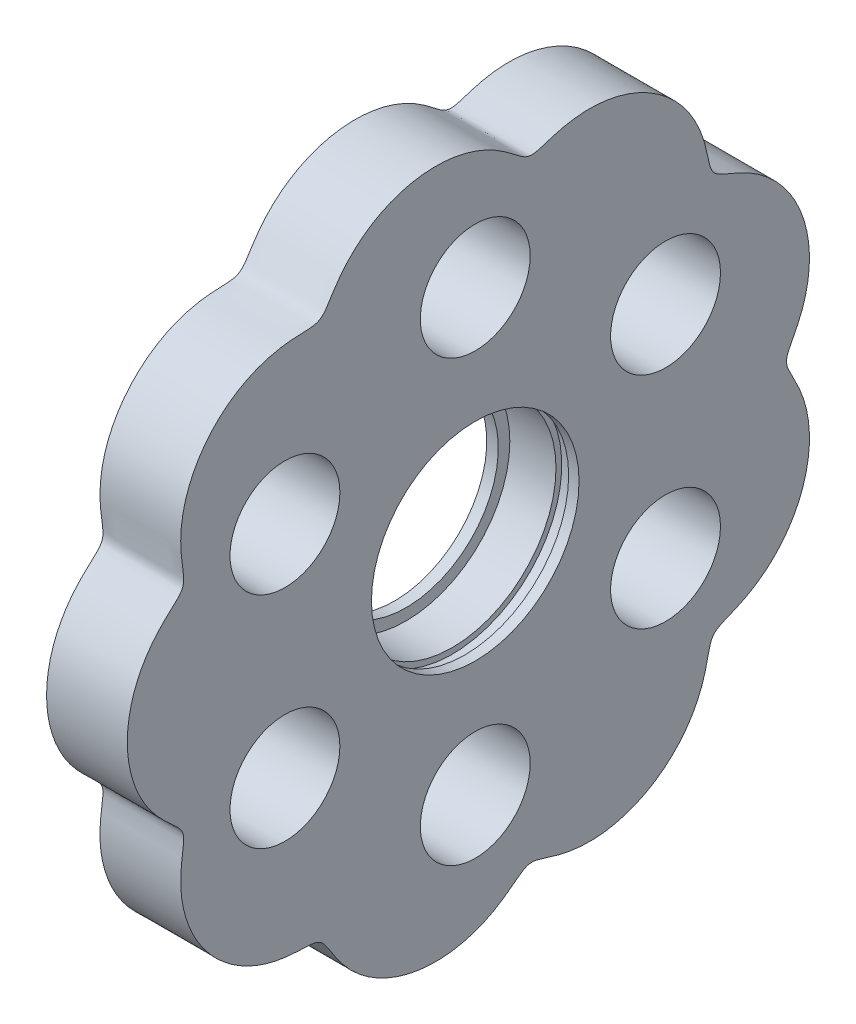
from build123d import *

# Parameters (mm, degrees)
SKETCH1_R           = 9
SKETCH1_R_2         = 4.7625
BOSS_EXTRUDE1_DEPTH = 7
SKETCH2_R           = 9
SKETCH2_R_2         = 8
BOSS_EXTRUDE2_DEPTH = 1
SKETCH3_W           = 1.1
SKETCH3_H           = 0.5


with BuildPart() as part:
    # Sketch1 → Boss-Extrude1 (new body)
    with BuildSketch(Plane(origin=(0, 0, 0), x_dir=(0, 0, -1), z_dir=(1, 0, 0))):
        with BuildLine():
            ThreePointArc((26.9875, 0), (26.989123063, 0.064428515), (26.993988134, 0.128693583))
            add(Edge.make_bspline(
                [(26.9875, 0), (26.9875, -0.014073053), (26.988080566, -0.04216838), (26.990693151, -0.098787465), (26.997566131, -0.167176816), (27.011607904, -0.256879897), (27.033011718, -0.352674617), (27.0616083, -0.450501981), (27.098613831, -0.556498791), (27.133591317, -0.6462128), (27.183968387, -0.76444502), (27.252007699, -0.910080875), (27.336032854, -1.077701998), (27.455718752, -1.30705574), (27.597856204, -1.57474085), (27.80354162, -1.969957187), (28.145202617, -2.675735442), (28.540539243, -3.68089166), (28.877472665, -5.016535689), (29.022846048, -6.583933195), (28.928181395, -8.154951368), (28.601973214, -9.68098236), (28.059488998, -11.129567329), (27.318557234, -12.472277494), (26.398579392, -13.682406664), (25.310802865, -14.74486271), (24.07633584, -15.632357808), (22.956941414, -16.211533455), (22.030542721, -16.581356678), (21.383868913, -16.848359145), (21.039971521, -17.024040788), (20.780870826, -17.218046158), (20.591835225, -17.434787286), (20.448078085, -17.697233393), (20.341895515, -18.007222586), (20.229665409, -18.462096546), (20.112569683, -19.033830244), (19.913989937, -19.89900933), (19.550925005, -21.036166088), (18.958770336, -22.300031894), (18.065217297, -23.621119938), (16.978610669, -24.788373978), (15.741019462, -25.766354253), (14.387035597, -26.540708274), (12.950394161, -27.102330148), (11.464153861, -27.444757575), (9.943334465, -27.564927227), (8.421845995, -27.455332003), (7.187326629, -27.181326733), (6.23642371, -26.869347958), (5.567462677, -26.656649116), (5.190408681, -26.568056964), (4.865818731, -26.546968949), (4.57811405, -26.588573801), (4.247438806, -26.715195963), (3.836602547, -26.983308712), (3.342170064, -27.376164818), (2.74947569, -27.832837508), (2.084212051, -28.286030242), (1.213182535, -28.790565586), (0.109473529, -29.285207916), (-1.245718232, -29.687650048), (-2.847070207, -29.899957538), (-4.426522985, -29.863959108), (-5.947788484, -29.600335351), (-7.381258538, -29.131775206), (-8.703129432, -28.482181721), (-9.919254868, -27.651038413), (-10.867639742, -26.778009507), (-11.58362681, -25.93899488), (-12.090852754, -25.226953653), (-12.440028359, -24.682791811), (-12.736830946, -24.203445712), (-12.982364886, -23.837092066), (-13.216107359, -23.570065907), (-13.434177591, -23.397800593), (-13.670159341, -23.274480892), (-14.000905649, -23.181745617), (-14.425656849, -23.139600671), (-14.975034767, -23.120006194), (-15.622856272, -23.095882497), (-16.50593349, -23.02436616), (-17.615249036, -22.836843964), (-18.875365012, -22.460967602), (-20.236499778, -21.824544859), (-21.490724146, -20.997180204), (-22.63467053, -19.979923375), (-23.636725931, -18.784677885), (-24.464062632, -17.42863273), (-25.083690088, -15.934696207), (-25.461721435, -14.362255153), (-25.570828603, -12.950927687), (-25.506495854, -11.74237763), (-25.380365115, -10.800480122), (-25.287411353, -10.175027104), (-25.25963281, -9.684803049), (-25.314095915, -9.334663135), (-25.420721025, -9.064252635), (-25.600274198, -8.793252002), (-25.864764818, -8.510883351), (-26.382650012, -8.038193121), (-27.127720365, -7.371798126), (-27.982030176, -6.441402818), (-28.837954408, -5.180901915), (-29.495183969, -3.806062027), (-29.94311642, -2.350053495), (-30.177254576, -0.826195581), (-30.185874838, 0.733440545), (-29.960095693, 2.295694142), (-29.493640049, 3.822304736), (-28.797820113, 5.259763753), (-27.884418183, 6.569238829), (-26.994431911, 7.50405728), (-26.253336372, 8.148256025), (-25.769102971, 8.608171885), (-25.553978155, 8.855946804), (-25.397019284, 9.110691557), (-25.30293408, 9.382642127), (-25.263221211, 9.703518696), (-25.282456668, 10.088920544), (-25.374048262, 10.781632118), (-25.517300453, 11.767668356), (-25.576296942, 13.025153717), (-25.42666346, 14.53638023), (-25.052582334, 16.008414726), (-24.467111281, 17.409320907), (-23.680470956, 18.717285819), (-22.708233593, 19.90351351), (-21.567667283, 20.941203206), (-20.280068994, 21.803114671), (-18.877714539, 22.463570392), (-17.391291781, 22.902414021), (-16.112637698, 23.07968363), (-15.084384726, 23.115536356), (-14.359501845, 23.143493211), (-13.955712395, 23.19080958), (-13.634478417, 23.288447903), (-13.379834632, 23.430827263), (-13.155584092, 23.631444328), (-12.949211344, 23.886939485), (-12.580401124, 24.444468974), (-12.073907425, 25.286831056), (-11.306407973, 26.326164589), (-10.173343113, 27.453209084), (-8.876336724, 28.387687796), (-7.451689225, 29.111233527), (-5.950982478, 29.603202821), (-4.413175486, 29.863509909), (-2.872527537, 29.895554112), (-1.362591729, 29.705707948), (0.10360915, 29.296117618), (1.49164383, 28.671479963), (2.554716554, 27.991679092), (3.33934148, 27.373945105), (3.894388658, 26.946672213), (4.218412505, 26.735884249), (4.51667439, 26.607085074), (4.801732044, 26.550079994), (5.156132367, 26.558446965), (5.634433041, 26.671618961), (6.23459598, 26.872301315), (6.949405927, 27.098694066), (7.731470525, 27.296440487), (8.724899522, 27.471435917), (9.933971843, 27.55666456), (11.347888837, 27.468104937), (12.927760468, 27.115310913), (14.406972451, 26.533742135), (15.757029902, 25.752706862), (16.955706407, 24.801666223), (17.985990191, 23.710090691), (18.84698722, 22.480470583), (19.434343194, 21.305433579), (19.810478267, 20.246291911), (20.033599791, 19.389804404), (20.169501935, 18.756571702), (20.28430602, 18.219580559), (20.399841969, 17.809026309), (20.551733624, 17.495626255), (20.734487504, 17.262022761), (21.007572085, 17.03886371), (21.444290497, 16.8165815), (22.03105794, 16.5849727), (22.722183108, 16.300601098), (23.446719313, 15.951962573), (24.318616531, 15.451198217), (25.298451348, 14.744471811), (26.324529604, 13.774342573), (27.309628, 12.49642479), (28.087646415, 11.079953494), (28.640949568, 9.558708419), (28.955224414, 7.96795843), (29.011501356, 6.547822686), (28.899775046, 5.336726365), (28.700543823, 4.344408554), (28.506356832, 3.663038222), (28.302415741, 3.091310121), (28.07057771, 2.53053344), (27.877552086, 2.118310301), (27.69384139, 1.757954672), (27.528894875, 1.444954361), (27.434434643, 1.266088979), (27.347441484, 1.099666827), (27.26921397, 0.944489687), (27.20056384, 0.80083933), (27.141912562, 0.667887367), (27.094321745, 0.546964905), (27.060914308, 0.447080156), (27.039218157, 0.37123785), (27.026252808, 0.319969907), (27.016880594, 0.277841028), (27.006334963, 0.222052254), (26.999198427, 0.17367455), (26.99580233, 0.146776423), (26.993988134, 0.128693583)],
                knots=[0.077183246, 0.077183246, 0.077183246, 0.077183246, 0.077183246, 0.077474152, 0.077765057, 0.078055963, 0.078346868, 0.079094128, 0.079467758, 0.079841388, 0.080310017, 0.080778646, 0.081715905, 0.082653163, 0.083590421, 0.085304709, 0.087018996, 0.090447571, 0.097306828, 0.104163675, 0.111021962, 0.117880006, 0.124738043, 0.131363748, 0.137989237, 0.144616048, 0.151241125, 0.157866255, 0.164493198, 0.166590404, 0.168687611, 0.170110071, 0.171228793, 0.172220692, 0.173681288, 0.175312422, 0.176943557, 0.180417041, 0.183890526, 0.190839242, 0.197786621, 0.204734377, 0.211682578, 0.218630695, 0.225278183, 0.231925354, 0.238574163, 0.245221229, 0.251867473, 0.258516731, 0.260620834, 0.262724936, 0.264152067, 0.265274335, 0.266279272, 0.267774268, 0.270299327, 0.27381867, 0.277338012, 0.280856247, 0.284374482, 0.291411815, 0.298448261, 0.305485882, 0.312523361, 0.318943925, 0.325364487, 0.331785312, 0.33820586, 0.344627383, 0.347837219, 0.351047055, 0.353492231, 0.355937407, 0.357702509, 0.358757067, 0.359672801, 0.360775588, 0.362332118, 0.364727215, 0.367122313, 0.370397111, 0.373671909, 0.38022026, 0.386768627, 0.393318704, 0.399867277, 0.406416022, 0.413461423, 0.42050696, 0.427551472, 0.4345965, 0.441641239, 0.445164421, 0.448687603, 0.451215633, 0.452712265, 0.453718326, 0.454839358, 0.456264861, 0.458366559, 0.460468257, 0.467109796, 0.473748624, 0.48038803, 0.487029188, 0.493668791, 0.500308689, 0.507264603, 0.514220591, 0.521176274, 0.528131234, 0.535087921, 0.542042659, 0.543675668, 0.545308678, 0.54677088, 0.547763875, 0.548881363, 0.550302196, 0.552397002, 0.554491807, 0.561110946, 0.567728748, 0.574346157, 0.580965292, 0.587583223, 0.594201344, 0.600954477, 0.607707543, 0.614461278, 0.621213074, 0.62796803, 0.634721399, 0.636963372, 0.639205345, 0.640666306, 0.641809402, 0.642803349, 0.644266949, 0.645901547, 0.647536145, 0.654497727, 0.661461194, 0.668422896, 0.675385469, 0.682348228, 0.689310923, 0.69594422, 0.702577258, 0.709211745, 0.715844487, 0.722476944, 0.729111693, 0.731211301, 0.73331091, 0.734734997, 0.735854955, 0.736861994, 0.738360049, 0.740890664, 0.744417186, 0.747943708, 0.751469673, 0.754995638, 0.762047357, 0.76909888, 0.7761513, 0.783203591, 0.789745847, 0.79628789, 0.8028315, 0.809373316, 0.815915302, 0.819186848, 0.822458394, 0.824851081, 0.827243768, 0.828798762, 0.82990049, 0.830904303, 0.832397664, 0.834919755, 0.838435118, 0.841950481, 0.845464722, 0.848978964, 0.856008601, 0.863036981, 0.870066685, 0.877096242, 0.884171933, 0.891247663, 0.898323272, 0.901860916, 0.905398559, 0.908936899, 0.910706069, 0.912475238, 0.916012925, 0.916897347, 0.917781769, 0.918666191, 0.919550612, 0.920185109, 0.920819605, 0.921454102, 0.922088599, 0.922464267, 0.922652102, 0.922839936, 0.923027771, 0.923215605, 0.923591274, 0.923591274, 0.923591274, 0.923591274, 0.923591274], degree=4))
        make_face()
        Circle(SKETCH1_R, mode=Mode.SUBTRACT)
        with Locations((0, 19.05)):
            Circle(SKETCH1_R_2, mode=Mode.SUBTRACT)
        with Locations((16.497783942, 9.525)):
            Circle(SKETCH1_R_2, mode=Mode.SUBTRACT)
        with Locations((16.497783942, -9.525)):
            Circle(SKETCH1_R_2, mode=Mode.SUBTRACT)
        with Locations((0, -19.05)):
            Circle(SKETCH1_R_2, mode=Mode.SUBTRACT)
        with Locations((-16.497783942, -9.525)):
            Circle(SKETCH1_R_2, mode=Mode.SUBTRACT)
        with Locations((-16.497783942, 9.525)):
            Circle(SKETCH1_R_2, mode=Mode.SUBTRACT)
    extrude(amount=BOSS_EXTRUDE1_DEPTH)

    # Sketch2 → Boss-Extrude2 (add)
    with BuildSketch(Plane.ZY):
        Circle(SKETCH2_R)
        Circle(SKETCH2_R_2, mode=Mode.SUBTRACT)
    extrude(amount=-BOSS_EXTRUDE2_DEPTH)

    # Sketch3 → Cut-Revolve1 (revolve, cut)
    with BuildSketch(Plane.XY):
        with Locations((5.55, 9.25)):
            Rectangle(SKETCH3_W, SKETCH3_H)
    revolve(axis=Axis((0, 0, 0), (1, 0, 0)), mode=Mode.SUBTRACT)


solid = part.part
